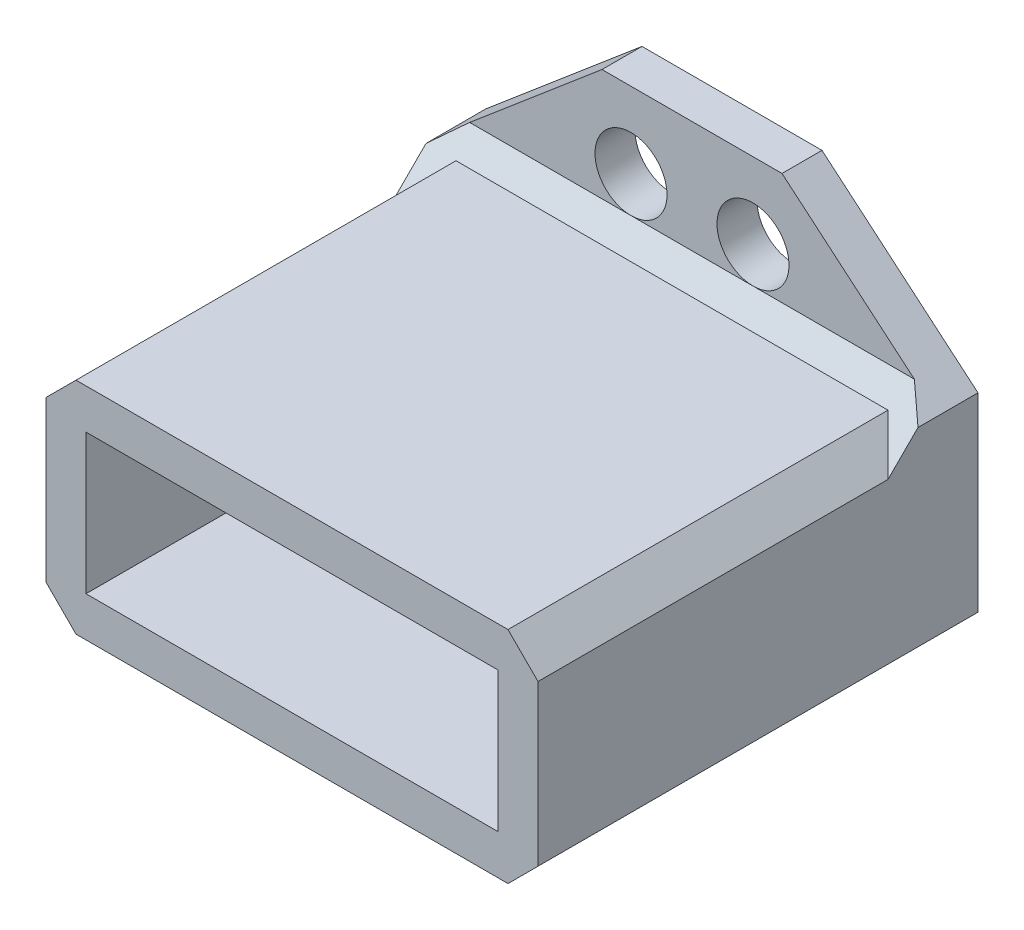
from build123d import *

# Parameters (mm, degrees)
ESBO_O1_W                = 24.6
ESBO_O1_H                = 11
ESBO_O1_W_2              = 20.6
ESBO_O1_H_2              = 7
RESSALTO_EXTRUS_O1_DEPTH = 10
ESBO_O2_R                = 1.8
ESBO_O2_W                = 20.6
ESBO_O2_H                = 7
RESSALTO_EXTRUS_O2_DEPTH = 2
CHANFRO4_SIZE            = 1
CHANFRO2_SIZE            = 1.5
ESBO_O3_W                = 3.653589711
ESBO_O3_H                = 7
ESBO_O3_W_2              = 3.653589584
RESSALTO_EXTRUS_O3_DEPTH = 3
FILETE3_R                = 2


with BuildPart() as part:
    # Esboço1 → Ressalto-extrusão1 (new, symmetric)
    with BuildSketch(Plane.XY):
        Rectangle(ESBO_O1_W, ESBO_O1_H)
        Rectangle(ESBO_O1_W_2, ESBO_O1_H_2, mode=Mode.SUBTRACT)
    extrude(amount=RESSALTO_EXTRUS_O1_DEPTH, both=True)

    # Esboço2 → Ressalto-extrusão2 (add)
    with BuildSketch(Plane(origin=(0, 0, -10), x_dir=(-1, 0, 0), z_dir=(0, 0, -1))):
        Polygon((-12.3, -5.5), (-12.3, 5.5), (-4.5, 12.1), (4.5, 12.1), (12.3, 5.5), (12.3, -5.5), align=None)
        with Locations((-3.05, 8.3)):
            Circle(ESBO_O2_R, mode=Mode.SUBTRACT)
        with Locations(Location((3.05, 8.3, 0), (0, 0, 180))):
            Circle(ESBO_O2_R, mode=Mode.SUBTRACT)
        Rectangle(ESBO_O2_W, ESBO_O2_H, mode=Mode.SUBTRACT)
    extrude(amount=RESSALTO_EXTRUS_O2_DEPTH)

    # Chanfro4
    chanfro4_edges = [part.edges().sort_by_distance(p)[0] for p in [
        (0, 5.5, -10),
    ]]
    chamfer(chanfro4_edges, length=CHANFRO4_SIZE - 0.0001)  # a hair under: the kernel refuses the full size

    # Chanfro2
    chanfro2_edges = [part.edges().sort_by_distance(p)[0] for p in [
        (12.3, 5.5, 0.49995),
        (12.3, -5.5, -1),
        (-12.3, -5.5, -1),
        (-12.3, 5.5, 0.49995),
    ]]
    chamfer(chanfro2_edges, length=CHANFRO2_SIZE)

    # Esboço3 → Ressalto-extrusão3 (add)
    with BuildSketch(Plane.XY.offset(-0.75)):
        with Locations((-5.000000063, 0)):
            Rectangle(ESBO_O3_W, ESBO_O3_H)
        with Locations((5, 0)):
            Rectangle(ESBO_O3_W_2, ESBO_O3_H)
    extrude(amount=-RESSALTO_EXTRUS_O3_DEPTH)

    # Filete3
    filete3_edges = [part.edges().sort_by_distance(p)[0] for p in [
        (-5.000000064, 3.5, -3.75),
        (-5.000000064, -3.5, -3.75),
        (5, 3.5, -3.75),
        (5, -3.5, -3.75),
    ]]
    fillet(filete3_edges, radius=FILETE3_R)


solid = part.part
